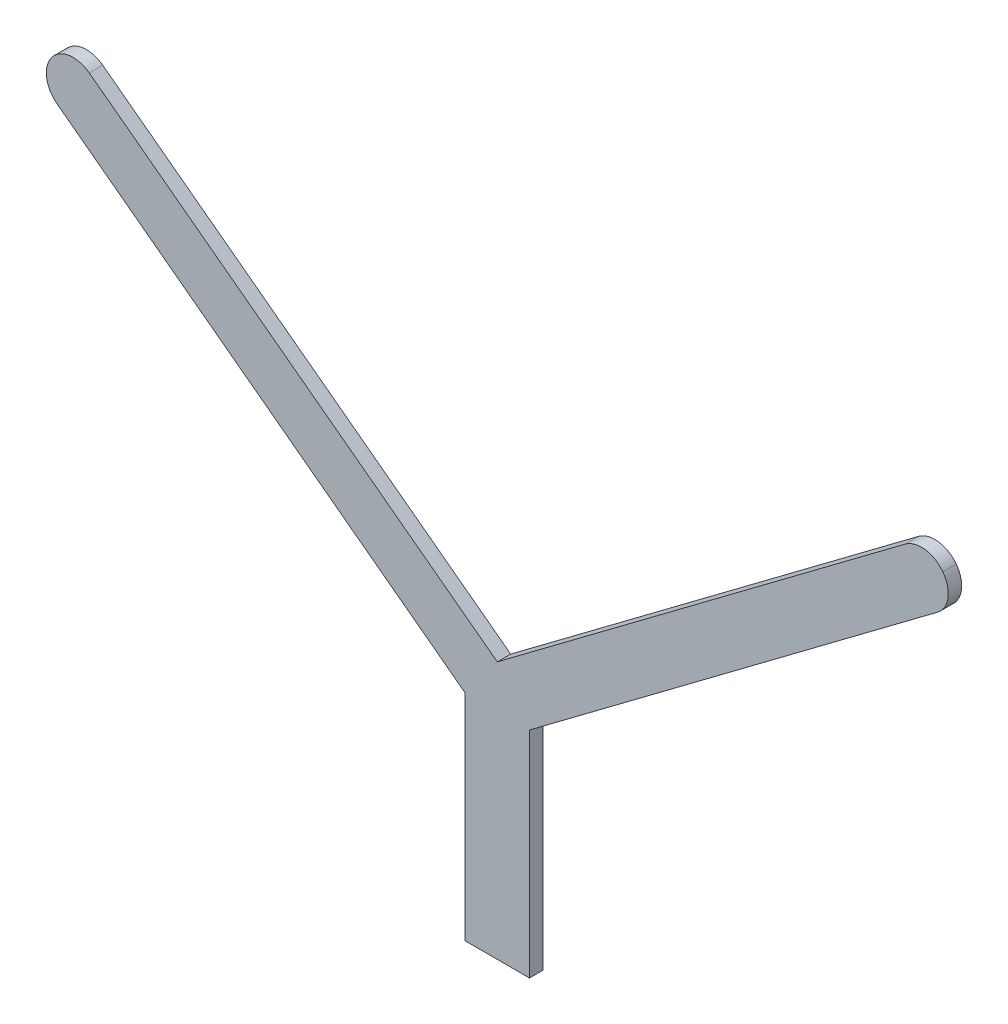
from build123d import *

# Parameters (mm, degrees)
BOSS_EXTRUDE2_DEPTH = 6.35
FILLET1_R           = 12.7
FILLET2_R           = 12.7
FILLET3_R           = 12.7
FILLET4_R           = 12.7


with BuildPart() as part:
    # Sketch6 → Boss-Extrude2 (new body)
    with BuildSketch(Plane.XY):
        Polygon((-203.2, -355.396143874), (0, -507.797500764), (203.2, -355.396143874), (218.440086841, -375.716078743), (15.240086841, -528.117435634), (15.240086841, -629.717435634), (-15.240086841, -629.717435634), (-15.240086841, -528.117435634), (-218.440086841, -375.716078743), align=None)
    extrude(amount=BOSS_EXTRUDE2_DEPTH)

    # Fillet1
    fillet1_edges = [part.edges().sort_by_distance(p)[0] for p in [
        (203.2, -355.396143874, 3.175),
    ]]
    fillet(fillet1_edges, radius=FILLET1_R)

    # Fillet2
    fillet2_edges = [part.edges().sort_by_distance(p)[0] for p in [
        (218.440086841, -375.716078743, 3.175),
    ]]
    fillet(fillet2_edges, radius=FILLET2_R - 0.0001)  # a hair under: the kernel refuses the full size

    # Fillet3
    fillet3_edges = [part.edges().sort_by_distance(p)[0] for p in [
        (-203.2, -355.396143874, 3.175),
    ]]
    fillet(fillet3_edges, radius=FILLET3_R)

    # Fillet4
    fillet4_edges = [part.edges().sort_by_distance(p)[0] for p in [
        (-218.440086841, -375.716078743, 3.175),
    ]]
    fillet(fillet4_edges, radius=FILLET4_R - 0.0001)  # a hair under: the kernel refuses the full size


solid = part.part
